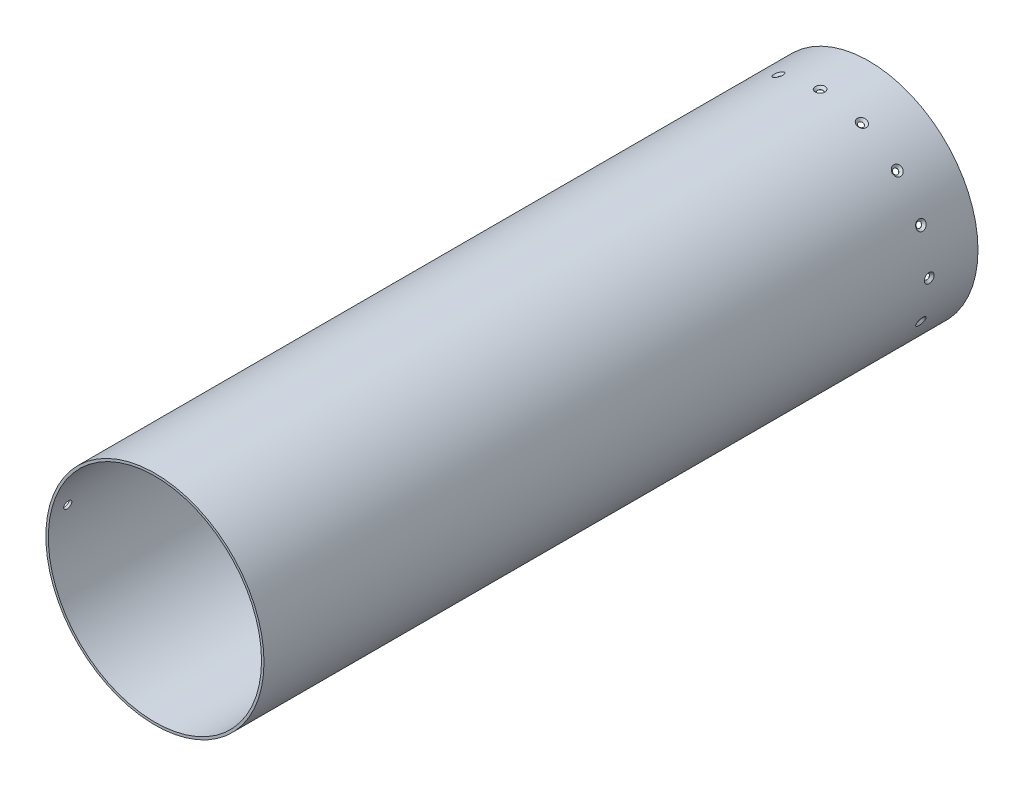
from build123d import *

# Parameters (mm, degrees)
SKETCH1_R                                       = 69.85
SKETCH1_R_2                                     = 68.2625
EXTRUDE1_DEPTH                                  = 457.2
CSK_FOR_M3_FLAT_HEAD_MACHINE_SCREW1_D           = 3.4
CSK_FOR_M3_FLAT_HEAD_MACHINE_SCREW1_CSINK_D     = 6.3
CSK_FOR_M3_FLAT_HEAD_MACHINE_SCREW1_CSINK_ANGLE = 90
CIRPATTERN1_COUNT                               = 16
F_7_0_201_DIAMETER_HOLE1_D                      = 5.1054
F_7_0_201_DIAMETER_HOLE1_DEPTH                  = 10.16
F_7_0_201_DIAMETER_HOLE1_TIP                    = 1.533816902


with BuildPart() as part:
    # Sketch1 → Extrude1 (new body)
    with BuildSketch(Plane.XY):
        Circle(SKETCH1_R)
        Circle(SKETCH1_R_2, mode=Mode.SUBTRACT)
    extrude(amount=EXTRUDE1_DEPTH)

    # CSK for M3 Flat Head Machine Screw1 (through all)
    with Locations(Plane(origin=(0, -69.85, 31.242), x_dir=(1, 0, 0), z_dir=(0, -1, 0))):
        with Locations((0, 0)):
            csk_for_m3_flat_head_machine_screw1 = CounterSinkHole(CSK_FOR_M3_FLAT_HEAD_MACHINE_SCREW1_D / 2, CSK_FOR_M3_FLAT_HEAD_MACHINE_SCREW1_CSINK_D / 2, counter_sink_angle=CSK_FOR_M3_FLAT_HEAD_MACHINE_SCREW1_CSINK_ANGLE)

    # CirPattern1: CSK for M3 Flat Head Machine Screw1 ×16 about axis
    cirpattern1_axis = Axis((0, 0, 457.2), (0, 0, -1))
    for i in range(1, CIRPATTERN1_COUNT):
        add(csk_for_m3_flat_head_machine_screw1.rotate(cirpattern1_axis, i * 360 / CIRPATTERN1_COUNT), mode=Mode.SUBTRACT)

    # #7 (0.201) Diameter Hole1
    with Locations(Plane(origin=(-68.507851836, 13.627058993, 228.6), x_dir=(0.19509032201613552, 0.9807852804032291, 0), z_dir=(-0.9807852804032291, 0.19509032201613552, 0))):
        with Locations((0, -217.4748)):
            Hole(F_7_0_201_DIAMETER_HOLE1_D / 2, depth=F_7_0_201_DIAMETER_HOLE1_DEPTH)
            with Locations((0, 0, -(F_7_0_201_DIAMETER_HOLE1_DEPTH + F_7_0_201_DIAMETER_HOLE1_TIP / 2))):  # 118° drill point
                Cone(0, F_7_0_201_DIAMETER_HOLE1_D / 2, F_7_0_201_DIAMETER_HOLE1_TIP, mode=Mode.SUBTRACT)


solid = part.part
